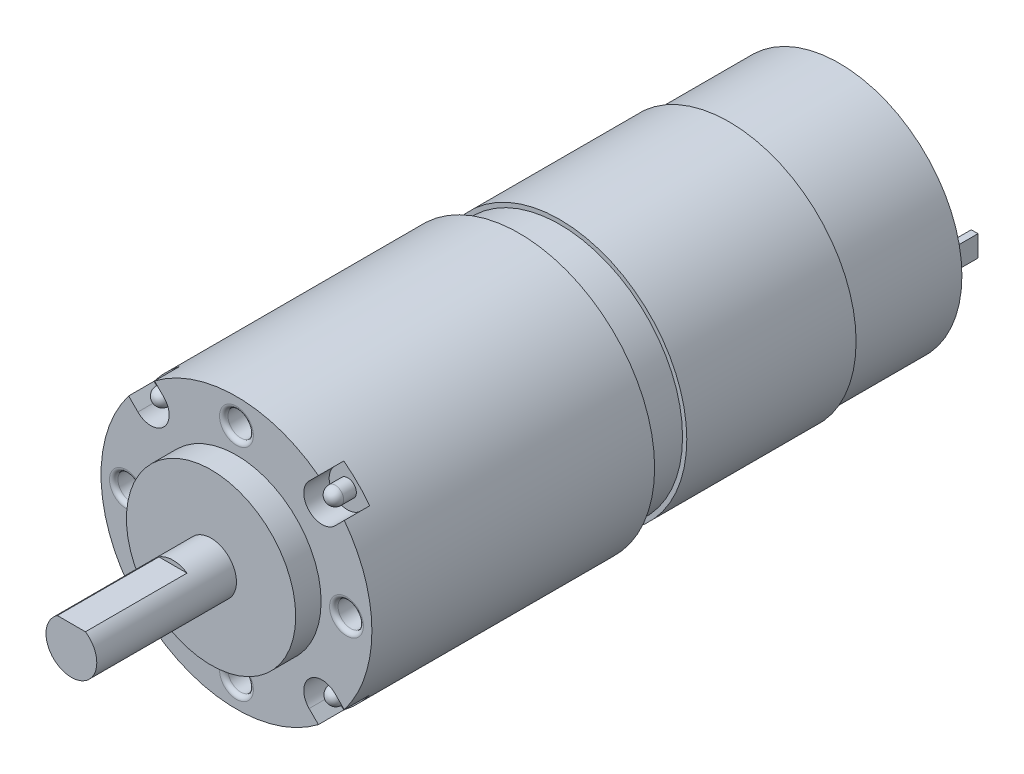
from build123d import *

# Parameters (mm, degrees)
ENL_V_MAT_EXTRU_1_DEPTH = 12
ESQUISSE3_W             = 0.8
ESQUISSE3_H             = 2.5
BOSS_EXTRU_1_DEPTH      = 4
ESQUISSE4_R             = 1.5
ENL_V_MAT_EXTRU_2_DEPTH = 4
CONG_2_R                = 0.5
ENL_V_MAT_EXTRU_3_DEPTH = 3
ESQUISSE6_R             = 1.00558737
BOSS_EXTRU_2_DEPTH      = 2.5
CONG_3_R                = 1


with BuildPart() as part:
    # Esquisse1 → Révolution1 (revolve)
    with BuildSketch(Plane(origin=(0, 0, 0), x_dir=(0, 0, -1), z_dir=(1, 0, 0))):
        with BuildLine():
            Line((-30.926143859, 0), (61.773856141, 0))
            Line((61.773856141, 0), (61.773856141, 3.884381115))
            Line((61.773856141, 3.884381115), (59.773856141, 3.884381115))
            Line((59.773856141, 3.884381115), (59.773856141, 14.5))
            Line((59.773856141, 14.5), (46.773856141, 14.5))
            Line((46.773856141, 14.5), (46.773856141, 15))
            Line((46.773856141, 15), (26.773856141, 15))
            Line((26.773856141, 15), (26.773856141, 14.5))
            Line((26.773856141, 14.5), (22.973856141, 14.5))
            ThreePointArc((22.973856141, 14.5), (22.266749359, 14.207106781), (21.973856141, 13.5))
            Line((21.973856141, 13.5), (21.973856141, 14.5))
            Line((21.973856141, 14.5), (21.973856141, 16))
            Line((21.973856141, 16), (-11.426143859, 16))
            Line((-11.426143859, 16), (-11.426143859, 10))
            Line((-11.426143859, 10), (-14.426143859, 10))
            Line((-14.426143859, 10), (-14.426143859, 3))
            Line((-14.426143859, 3), (-30.926143859, 3))
            Line((-30.926143859, 3), (-30.926143859, 0))
        make_face()
    revolve(axis=Axis((0, 0, 20.6), (0, 0, -1)))

    # Esquisse2 → Enlèv. mat.-Extru.1 (cut)
    with BuildSketch(Plane.XY.offset(30.926143859)):
        with BuildLine():
            Line((-1.658312395, 2.5), (1.658312395, 2.5))
            ThreePointArc((1.658312395, 2.5), (0, 3), (-1.658312395, 2.5))
        make_face()
    extrude(amount=-ENL_V_MAT_EXTRU_1_DEPTH, mode=Mode.SUBTRACT)

    # Esquisse3 → Boss.-Extru.1 (add)
    with BuildSketch(Plane(origin=(0, 0, -59.773856141), x_dir=(-1, 0, 0), z_dir=(0, 0, -1))):
        with Locations((-12, 0)):
            Rectangle(ESQUISSE3_W, ESQUISSE3_H)
        with Locations((12, 0)):
            Rectangle(ESQUISSE3_W, ESQUISSE3_H)
    extrude(amount=BOSS_EXTRU_1_DEPTH)

    # Esquisse4 → Enlèv. mat.-Extru.2 (cut)
    with BuildSketch(Plane.XY.offset(11.426143859)):
        with Locations((13, 0)):
            Circle(ESQUISSE4_R)
        with Locations((0, -13)):
            Circle(ESQUISSE4_R)
        with Locations((-13, 0)):
            Circle(ESQUISSE4_R)
        with Locations((0, 13)):
            Circle(ESQUISSE4_R)
    extrude(amount=-ENL_V_MAT_EXTRU_2_DEPTH, mode=Mode.SUBTRACT)

    # Congé2
    cong_2_edges = [part.edges().sort_by_distance(p)[0] for p in [
        (-1.5, 13, 11.426143859),
        (-14.5, 0, 11.426143859),
        (-1.5, -13, 11.426143859),
        (11.5, 0, 11.426143859),
    ]]
    fillet(cong_2_edges, radius=CONG_2_R)

    # Esquisse5 → Enlèv. mat.-Extru.3 (cut)
    with BuildSketch(Plane.XY.offset(11.426143859)):
        with BuildLine():
            Line((-11.64124723, 8.583366209), (-14.238773212, 11.18089219))
            ThreePointArc((-14.238773212, 11.18089219), (-14.238773212, 14.238773212), (-11.18089219, 14.238773212))
            Line((-11.18089219, 14.238773212), (-8.583366209, 11.64124723))
            ThreePointArc((-8.583366209, 11.64124723), (-8.583366209, 8.583366209), (-11.64124723, 8.583366209))
        make_face()
        with BuildLine():
            Line((8.583366209, 11.64124723), (11.18089219, 14.238773212))
            ThreePointArc((11.18089219, 14.238773212), (14.238773212, 14.238773212), (14.238773212, 11.18089219))
            Line((14.238773212, 11.18089219), (11.64124723, 8.583366209))
            ThreePointArc((11.64124723, 8.583366209), (8.583366209, 8.583366209), (8.583366209, 11.64124723))
        make_face()
        with BuildLine():
            Line((11.64124723, -8.583366209), (14.238773212, -11.18089219))
            ThreePointArc((14.238773212, -11.18089219), (14.238773212, -14.238773212), (11.18089219, -14.238773212))
            Line((11.18089219, -14.238773212), (8.583366209, -11.64124723))
            ThreePointArc((8.583366209, -11.64124723), (8.583366209, -8.583366209), (11.64124723, -8.583366209))
        make_face()
        with BuildLine():
            Line((-8.583366209, -11.64124723), (-11.18089219, -14.238773212))
            ThreePointArc((-11.18089219, -14.238773212), (-14.238773212, -14.238773212), (-14.238773212, -11.18089219))
            Line((-14.238773212, -11.18089219), (-11.64124723, -8.583366209))
            ThreePointArc((-11.64124723, -8.583366209), (-8.583366209, -8.583366209), (-8.583366209, -11.64124723))
        make_face()
    extrude(amount=-ENL_V_MAT_EXTRU_3_DEPTH, mode=Mode.SUBTRACT)

    # Esquisse6 → Boss.-Extru.2 (add)
    with BuildSketch(Plane.XY.offset(8.426143859)):
        with Locations((-10.246357947, 10.159890792)):
            Circle(ESQUISSE6_R)
        with Locations((10.159890792, 10.246357947)):
            Circle(ESQUISSE6_R)
        with Locations((10.246357947, -10.159890792)):
            Circle(ESQUISSE6_R)
        with Locations((-10.159890792, -10.246357947)):
            Circle(ESQUISSE6_R)
    extrude(amount=BOSS_EXTRU_2_DEPTH)

    # Congé3
    cong_3_edges = [part.edges().sort_by_distance(p)[0] for p in [
        (-11.165478162, -10.246357947, 10.926143859),
        (-11.251945317, 10.159890792, 10.926143859),
        (9.154303422, 10.246357947, 10.926143859),
        (9.240770577, -10.159890792, 10.926143859),
    ]]
    fillet(cong_3_edges, radius=CONG_3_R)


solid = part.part
